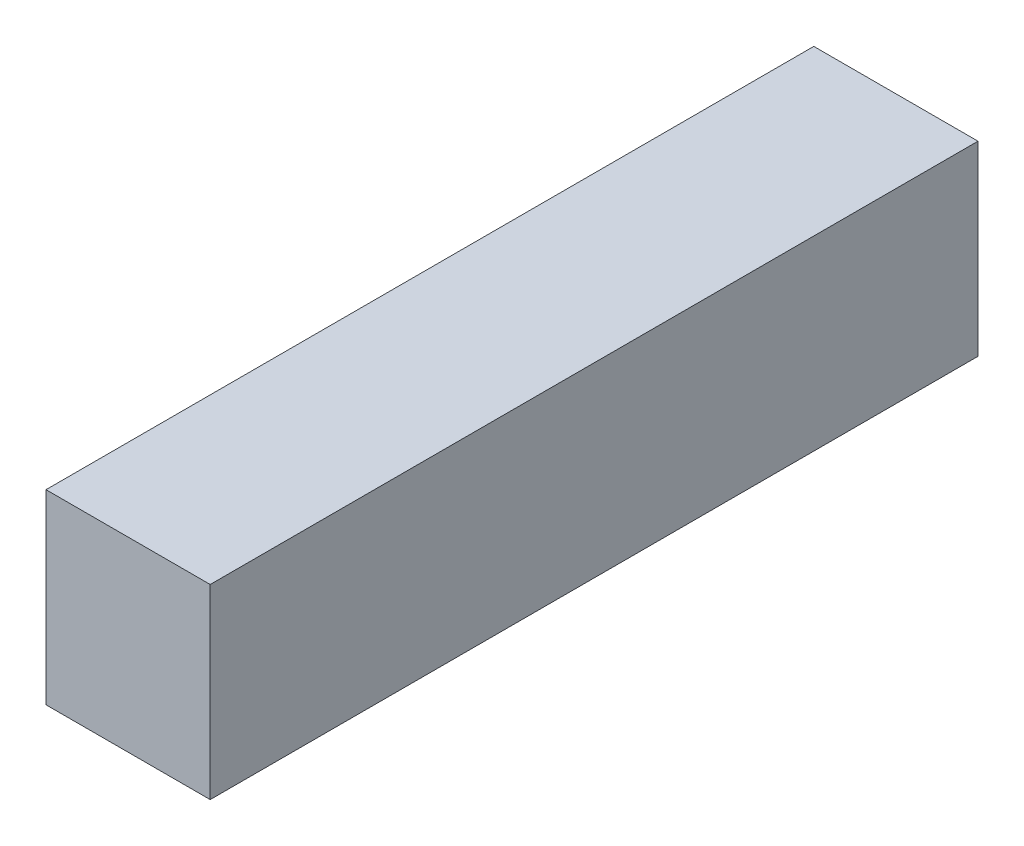
from build123d import *

# Parameters (mm, degrees)
SKETCH2_W           = 89.541086837
SKETCH2_H           = 418.697146856
BOSS_EXTRUDE1_DEPTH = 101.6


with BuildPart() as part:
    # Sketch2 → Boss-Extrude1 (new body)
    with BuildSketch(Plane(origin=(0, 0, 0), x_dir=(1, 0, 0), z_dir=(0, 1, 0))):
        with Locations((31.429456582, 222.451426572)):
            Rectangle(SKETCH2_W, SKETCH2_H)
    extrude(amount=BOSS_EXTRUDE1_DEPTH)


solid = part.part
